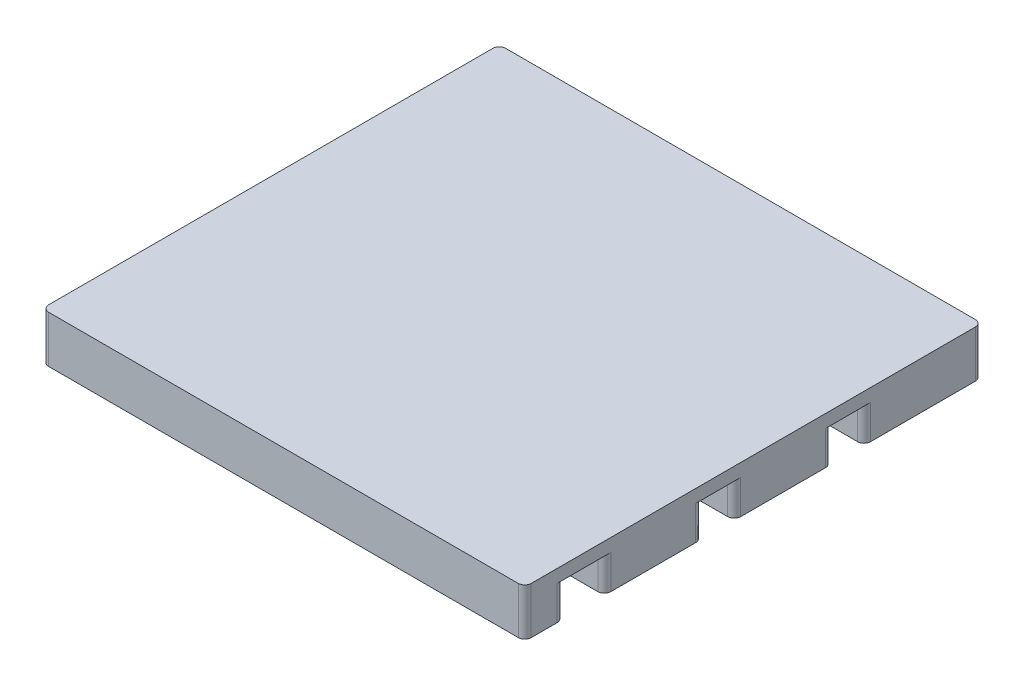
from build123d import *

# Parameters (mm, degrees)
SKETCH3_W           = 149
SKETCH3_H           = 141.12
BOSS_EXTRUDE1_DEPTH = 4
SKETCH5_W           = 67
SKETCH5_H           = 36.35
SKETCH5_H_2         = 30.2
BOSS_EXTRUDE2_DEPTH = 14.5
FILLET1_R           = 2
SKETCH6_W           = 149
SKETCH6_H           = 12
BOSS_EXTRUDE3_DEPTH = 10.5
FILLET2_R           = 2


with BuildPart() as part:
    # Sketch3 → Boss-Extrude1 (new body)
    with BuildSketch(Plane(origin=(0, 0, 0), x_dir=(1, 0, 0), z_dir=(0, 1, 0))):
        with Locations((74.5, -70.56)):
            Rectangle(SKETCH3_W, SKETCH3_H)
    extrude(amount=BOSS_EXTRUDE1_DEPTH)

    # Sketch5 → Boss-Extrude2 (add)
    # profile 1 of 6: a face of its own
    with BuildSketch(Plane(origin=(0, 4, 0), x_dir=(1, 0, 0), z_dir=(0, 1, 0))):
        with Locations((115.5, -18.175)):
            Rectangle(SKETCH5_W, SKETCH5_H)
        with BuildLine():
            ThreePointArc((97, -25.35), (93.9, -22.25), (97, -19.15))
            Line((97, -19.15), (125, -19.15))
            ThreePointArc((125, -19.15), (128.1, -22.25), (125, -25.35))
            Line((125, -25.35), (97, -25.35))
        make_face(mode=Mode.SUBTRACT)
    # profile 2 of 6: a face of its own
    with BuildSketch(Plane(origin=(0, 4, 0), x_dir=(1, 0, 0), z_dir=(0, 1, 0))):
        with Locations((115.5, -101.45)):
            Rectangle(SKETCH5_W, SKETCH5_H_2)
        with BuildLine():
            ThreePointArc((97, -105.55), (93.9, -102.45), (97, -99.35))
            Line((97, -99.35), (125, -99.35))
            ThreePointArc((125, -99.35), (128.1, -102.45), (125, -105.55))
            Line((125, -105.55), (97, -105.55))
        make_face(mode=Mode.SUBTRACT)
    # profile 3 of 6: a face of its own
    with BuildSketch(Plane(origin=(0, 4, 0), x_dir=(1, 0, 0), z_dir=(0, 1, 0))):
        with Locations((115.5, -61.35)):
            Rectangle(SKETCH5_W, SKETCH5_H_2)
        with BuildLine():
            ThreePointArc((97, -65.45), (93.9, -62.35), (97, -59.25))
            Line((97, -59.25), (125, -59.25))
            ThreePointArc((125, -59.25), (128.1, -62.35), (125, -65.45))
            Line((125, -65.45), (97, -65.45))
        make_face(mode=Mode.SUBTRACT)
    # profile 4 of 6: a face of its own
    with BuildSketch(Plane(origin=(0, 4, 0), x_dir=(1, 0, 0), z_dir=(0, 1, 0))):
        with Locations((33.5, -104)):
            Rectangle(SKETCH5_W, SKETCH5_H_2)
        with BuildLine():
            ThreePointArc((13, -108.1), (9.9, -105), (13, -101.9))
            Line((13, -101.9), (41, -101.9))
            ThreePointArc((41, -101.9), (44.1, -105), (41, -108.1))
            Line((41, -108.1), (13, -108.1))
        make_face(mode=Mode.SUBTRACT)
    # profile 5 of 6: a face of its own
    with BuildSketch(Plane(origin=(0, 4, 0), x_dir=(1, 0, 0), z_dir=(0, 1, 0))):
        with Locations((33.5, -63.9)):
            Rectangle(SKETCH5_W, SKETCH5_H_2)
        with BuildLine():
            ThreePointArc((13, -68), (9.9, -64.9), (13, -61.8))
            Line((13, -61.8), (41, -61.8))
            ThreePointArc((41, -61.8), (44.1, -64.9), (41, -68))
            Line((41, -68), (13, -68))
        make_face(mode=Mode.SUBTRACT)
    # profile 6 of 6: a face of its own
    with BuildSketch(Plane(origin=(0, 4, 0), x_dir=(1, 0, 0), z_dir=(0, 1, 0))):
        with Locations((33.5, -23.8)):
            Rectangle(SKETCH5_W, SKETCH5_H_2)
        with BuildLine():
            ThreePointArc((13, -27.9), (9.9, -24.8), (13, -21.7))
            Line((13, -21.7), (41, -21.7))
            ThreePointArc((41, -21.7), (44.1, -24.8), (41, -27.9))
            Line((41, -27.9), (13, -27.9))
        make_face(mode=Mode.SUBTRACT)
    extrude(amount=-BOSS_EXTRUDE2_DEPTH)

    # Fillet1
    fillet1_edges = [part.edges().sort_by_distance(p)[0] for p in [
        (149, -5.25, 86.35),
        (149, -5.25, 116.55),
        (82, -5.25, 116.55),
        (82, -5.25, 86.35),
        (67, -5.25, 88.9),
        (67, -5.25, 119.1),
        (0, -5.25, 119.1),
        (0, -5.25, 88.9),
        (0, -5.25, 79),
        (82, -5.25, 76.45),
        (149, -5.25, 76.45),
        (149, -5.25, 46.25),
        (82, -5.25, 46.25),
        (67, -5.25, 48.8),
        (67, -5.25, 79),
        (0, -5.25, 48.8),
        (0, -5.25, 38.9),
        (67, -5.25, 38.9),
        (82, -5.25, 36.35),
        (149, -5.25, 36.35),
        (149, -3.25, 0),
        (82, -5.25, 0),
        (67, -5.25, 8.7),
        (0, -5.25, 8.7),
    ]]
    fillet(fillet1_edges, radius=FILLET1_R)

    # Sketch6 → Boss-Extrude3 (add)
    with BuildSketch(Plane.XZ):
        with Locations((74.5, 135.12)):
            Rectangle(SKETCH6_W, SKETCH6_H)
    extrude(amount=BOSS_EXTRUDE3_DEPTH)

    # Fillet2
    fillet2_edges = [part.edges().sort_by_distance(p)[0] for p in [
        (149, -5.25, 129.12),
        (0, -5.25, 129.12),
        (0, -3.25, 141.12),
        (149, -3.25, 141.12),
        (0, 2, 0),
    ]]
    fillet(fillet2_edges, radius=FILLET2_R)


solid = part.part
